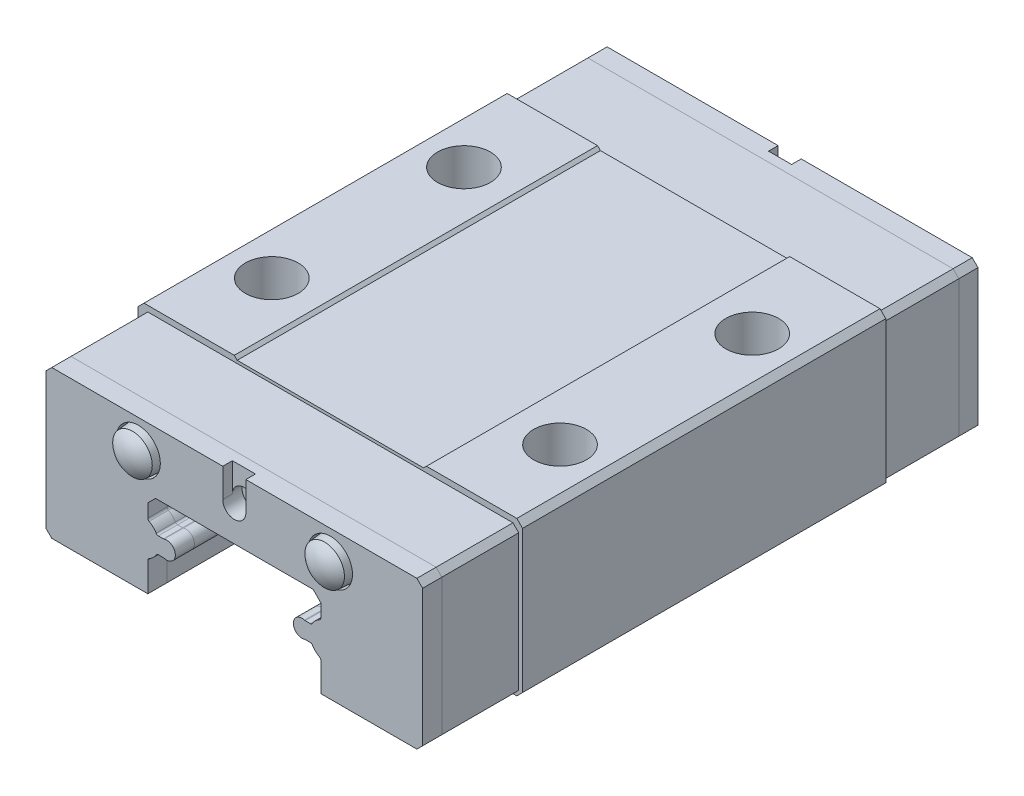
from build123d import *

# Parameters (mm, degrees)
BOSS_EXTRUDE1_DEPTH = 9.45
BOSS_EXTRUDE2_DEPTH = 4
BOSS_EXTRUDE3_DEPTH = 1
SKETCH5_R           = 0.6
CUT_EXTRUDE2_DEPTH  = 28.11475613
SKETCH6_R           = 1.15
SKETCH6_W           = 1.2
SKETCH6_H           = 1.5
CUT_EXTRUDE3_DEPTH  = 0.5
LPATTERN1_COUNT     = 2
LPATTERN1_PITCH     = 10
SKETCH2_R           = 1.375
CUT_EXTRUDE1_DEPTH  = 2.5


with BuildPart() as part:
    # Sketch1 → Boss-Extrude1 (new, symmetric)
    with BuildSketch(Plane.XY):
        with BuildLine():
            Line((4.5, 0), (9.7, 0))
            Line((9.7, 0), (10, 0.3))
            Line((10, 0.3), (10, 7.7))
            Line((10, 7.7), (9.7, 8))
            Line((9.7, 8), (5, 8))
            Line((5, 8), (4.85, 7.85))
            Line((4.85, 7.85), (-4.85, 7.85))
            Line((-4.85, 7.85), (-5, 8))
            Line((-5, 8), (-9.7, 8))
            Line((-9.7, 8), (-10, 7.7))
            Line((-10, 7.7), (-10, 0.3))
            Line((-10, 0.3), (-9.7, 0))
            Line((-9.7, 0), (-4.5, 0))
            Line((-4.5, 0), (-4.5, 1.508002101))
            ThreePointArc((-4.5, 1.508002101), (-4.481535993, 1.574783253), (-4.431388889, 1.622594441))
            ThreePointArc((-4.431388889, 1.622594441), (-4.224528747, 1.772353698), (-4.065036084, 1.971805556))
            ThreePointArc((-4.065036084, 1.971805556), (-4.01760557, 2.018103321), (-3.953514706, 2.035))
            Line((-3.953514706, 2.035), (-3.688448805, 2.035))
            ThreePointArc((-3.688448805, 2.035), (-3.669364148, 2.033591508), (-3.650693039, 2.029396552))
            ThreePointArc((-3.650693039, 2.029396552), (-3.07, 2.46), (-3.650693039, 2.890603448))
            ThreePointArc((-3.650693039, 2.890603448), (-3.669364148, 2.886408492), (-3.688448805, 2.885))
            Line((-3.688448805, 2.885), (-3.953514706, 2.885))
            ThreePointArc((-3.953514706, 2.885), (-4.01760557, 2.901896679), (-4.065036084, 2.948194444))
            ThreePointArc((-4.065036084, 2.948194444), (-4.224528747, 3.147646302), (-4.431388889, 3.297405559))
            ThreePointArc((-4.431388889, 3.297405559), (-4.481535993, 3.345216747), (-4.5, 3.411997899))
            Line((-4.5, 3.411997899), (-4.5, 4.1))
            Line((-4.5, 4.1), (-4.1, 4.5))
            Line((-4.1, 4.5), (4.1, 4.5))
            Line((4.1, 4.5), (4.5, 4.1))
            Line((4.5, 4.1), (4.5, 3.411997899))
            ThreePointArc((4.5, 3.411997899), (4.481535993, 3.345216747), (4.431388889, 3.297405559))
            ThreePointArc((4.431388889, 3.297405559), (4.224528747, 3.147646302), (4.065036084, 2.948194444))
            ThreePointArc((4.065036084, 2.948194444), (4.01760557, 2.901896679), (3.953514706, 2.885))
            Line((3.953514706, 2.885), (3.688448805, 2.885))
            ThreePointArc((3.688448805, 2.885), (3.669364148, 2.886408492), (3.650693039, 2.890603448))
            ThreePointArc((3.650693039, 2.890603448), (3.07, 2.46), (3.650693039, 2.029396552))
            ThreePointArc((3.650693039, 2.029396552), (3.669364148, 2.033591508), (3.688448805, 2.035))
            Line((3.688448805, 2.035), (3.953514706, 2.035))
            ThreePointArc((3.953514706, 2.035), (4.01760557, 2.018103321), (4.065036084, 1.971805556))
            ThreePointArc((4.065036084, 1.971805556), (4.224528747, 1.772353698), (4.431388889, 1.622594441))
            ThreePointArc((4.431388889, 1.622594441), (4.481535993, 1.574783253), (4.5, 1.508002101))
            Line((4.5, 1.508002101), (4.5, 0))
        make_face()
    extrude(amount=BOSS_EXTRUDE1_DEPTH, both=True)

    # Sketch2 → Cut-Extrude1 (cut)
    with BuildSketch(Plane(origin=(0, 8, 0), x_dir=(1, 0, 0), z_dir=(0, 1, 0))):
        with Locations((-7.5, 5)):
            Circle(SKETCH2_R)
        with Locations((7.5, 5)):
            Circle(SKETCH2_R)
        with Locations((7.5, -5)):
            Circle(SKETCH2_R)
        with Locations((-7.5, -5)):
            Circle(SKETCH2_R)
    extrude(amount=-CUT_EXTRUDE1_DEPTH, mode=Mode.SUBTRACT)


with BuildPart() as body_2:
    # Sketch3 → Boss-Extrude2 (new body)
    with BuildSketch(Plane.XY.offset(9.45)):
        with BuildLine():
            Line((9.5, 0), (9.8, 0.3))
            Line((9.8, 0.3), (9.8, 7.4))
            Line((9.8, 7.4), (9.5, 7.7))
            Line((9.5, 7.7), (-9.5, 7.7))
            Line((-9.5, 7.7), (-9.8, 7.4))
            Line((-9.8, 7.4), (-9.8, 0.3))
            Line((-9.8, 0.3), (-9.5, 0))
            Line((-9.5, 0), (-4.5, 0))
            Line((-4.5, 0), (-4.5, 1.508002101))
            ThreePointArc((-4.5, 1.508002101), (-4.481535993, 1.574783253), (-4.431388889, 1.622594441))
            ThreePointArc((-4.431388889, 1.622594441), (-4.224528747, 1.772353698), (-4.065036084, 1.971805556))
            ThreePointArc((-4.065036084, 1.971805556), (-4.01760557, 2.018103321), (-3.953514706, 2.035))
            Line((-3.953514706, 2.035), (-3.688448805, 2.035))
            ThreePointArc((-3.688448805, 2.035), (-3.669364148, 2.033591508), (-3.650693039, 2.029396552))
            ThreePointArc((-3.650693039, 2.029396552), (-3.07, 2.46), (-3.650693039, 2.890603448))
            ThreePointArc((-3.650693039, 2.890603448), (-3.669364148, 2.886408492), (-3.688448805, 2.885))
            Line((-3.688448805, 2.885), (-3.953514706, 2.885))
            ThreePointArc((-3.953514706, 2.885), (-4.01760557, 2.901896679), (-4.065036084, 2.948194444))
            ThreePointArc((-4.065036084, 2.948194444), (-4.224528747, 3.147646302), (-4.431388889, 3.297405559))
            ThreePointArc((-4.431388889, 3.297405559), (-4.481535993, 3.345216747), (-4.5, 3.411997899))
            Line((-4.5, 3.411997899), (-4.5, 4.1))
            Line((-4.5, 4.1), (-4.1, 4.5))
            Line((-4.1, 4.5), (4.1, 4.5))
            Line((4.1, 4.5), (4.5, 4.1))
            Line((4.5, 4.1), (4.5, 3.411997899))
            ThreePointArc((4.5, 3.411997899), (4.481535993, 3.345216747), (4.431388889, 3.297405559))
            ThreePointArc((4.431388889, 3.297405559), (4.224528747, 3.147646302), (4.065036084, 2.948194444))
            ThreePointArc((4.065036084, 2.948194444), (4.01760557, 2.901896679), (3.953514706, 2.885))
            Line((3.953514706, 2.885), (3.688448805, 2.885))
            ThreePointArc((3.688448805, 2.885), (3.669364148, 2.886408492), (3.650693039, 2.890603448))
            ThreePointArc((3.650693039, 2.890603448), (3.07, 2.46), (3.650693039, 2.029396552))
            ThreePointArc((3.650693039, 2.029396552), (3.669364148, 2.033591508), (3.688448805, 2.035))
            Line((3.688448805, 2.035), (3.953514706, 2.035))
            ThreePointArc((3.953514706, 2.035), (4.01760557, 2.018103321), (4.065036084, 1.971805556))
            ThreePointArc((4.065036084, 1.971805556), (4.224528747, 1.772353698), (4.431388889, 1.622594441))
            ThreePointArc((4.431388889, 1.622594441), (4.481535993, 1.574783253), (4.5, 1.508002101))
            Line((4.5, 1.508002101), (4.5, 0))
            Line((4.5, 0), (9.5, 0))
        make_face()
    extrude(amount=BOSS_EXTRUDE2_DEPTH)


with BuildPart() as body_3:
    # Sketch4 → Boss-Extrude3 (new body)
    with BuildSketch(Plane.XY.offset(13.45)):
        with BuildLine():
            Line((-4.5, 0), (-4.5, 1.508002101))
            ThreePointArc((-4.5, 1.508002101), (-4.481535993, 1.574783253), (-4.431388889, 1.622594441))
            ThreePointArc((-4.431388889, 1.622594441), (-4.224528747, 1.772353698), (-4.065036084, 1.971805556))
            ThreePointArc((-4.065036084, 1.971805556), (-4.01760557, 2.018103321), (-3.953514706, 2.035))
            Line((-3.953514706, 2.035), (-3.688448805, 2.035))
            ThreePointArc((-3.688448805, 2.035), (-3.669364148, 2.033591508), (-3.650693039, 2.029396552))
            ThreePointArc((-3.650693039, 2.029396552), (-3.07, 2.46), (-3.650693039, 2.890603448))
            ThreePointArc((-3.650693039, 2.890603448), (-3.669364148, 2.886408492), (-3.688448805, 2.885))
            Line((-3.688448805, 2.885), (-3.953514706, 2.885))
            ThreePointArc((-3.953514706, 2.885), (-4.01760557, 2.901896679), (-4.065036084, 2.948194444))
            ThreePointArc((-4.065036084, 2.948194444), (-4.224528747, 3.147646302), (-4.431388889, 3.297405559))
            ThreePointArc((-4.431388889, 3.297405559), (-4.481535993, 3.345216747), (-4.5, 3.411997899))
            Line((-4.5, 3.411997899), (-4.5, 4.1))
            Line((-4.5, 4.1), (-4.1, 4.5))
            Line((-4.1, 4.5), (4.1, 4.5))
            Line((4.1, 4.5), (4.5, 4.1))
            Line((4.5, 4.1), (4.5, 3.411997899))
            ThreePointArc((4.5, 3.411997899), (4.481535993, 3.345216747), (4.431388889, 3.297405559))
            ThreePointArc((4.431388889, 3.297405559), (4.224528747, 3.147646302), (4.065036084, 2.948194444))
            ThreePointArc((4.065036084, 2.948194444), (4.01760557, 2.901896679), (3.953514706, 2.885))
            Line((3.953514706, 2.885), (3.688448805, 2.885))
            ThreePointArc((3.688448805, 2.885), (3.669364148, 2.886408492), (3.650693039, 2.890603448))
            ThreePointArc((3.650693039, 2.890603448), (3.07, 2.46), (3.650693039, 2.029396552))
            ThreePointArc((3.650693039, 2.029396552), (3.669364148, 2.033591508), (3.688448805, 2.035))
            Line((3.688448805, 2.035), (3.953514706, 2.035))
            ThreePointArc((3.953514706, 2.035), (4.01760557, 2.018103321), (4.065036084, 1.971805556))
            ThreePointArc((4.065036084, 1.971805556), (4.224528747, 1.772353698), (4.431388889, 1.622594441))
            ThreePointArc((4.431388889, 1.622594441), (4.481535993, 1.574783253), (4.5, 1.508002101))
            Line((4.5, 1.508002101), (4.5, 0))
            Line((4.5, 0), (9.5, 0))
            Line((9.5, 0), (9.8, 0.3))
            Line((9.8, 0.3), (9.8, 7.4))
            Line((9.8, 7.4), (9.5, 7.7))
            Line((9.5, 7.7), (-9.5, 7.7))
            Line((-9.5, 7.7), (-9.8, 7.4))
            Line((-9.8, 7.4), (-9.8, 0.3))
            Line((-9.8, 0.3), (-9.5, 0))
            Line((-9.5, 0), (-4.5, 0))
        make_face()
    extrude(amount=BOSS_EXTRUDE3_DEPTH)

    # Sketch5 → Cut-Extrude2 (cut, through all)
    with BuildSketch(Plane.XY.offset(14.45)):
        with Locations((0, 6.2)):
            Circle(SKETCH5_R)
    extrude(amount=-CUT_EXTRUDE2_DEPTH, mode=Mode.SUBTRACT)

    # Sketch6 → Cut-Extrude3 (cut)
    with BuildSketch(Plane.XY.offset(14.45)):
        with Locations((-5, 6.2)):
            Circle(SKETCH6_R)
        with Locations((5, 6.2)):
            Circle(SKETCH6_R)
        with Locations((0, 6.95)):
            Rectangle(SKETCH6_W, SKETCH6_H)
    extrude(amount=-CUT_EXTRUDE3_DEPTH, mode=Mode.SUBTRACT)


with BuildPart() as body_4:
    # Sketch7 → Revolve1 (revolve)
    with BuildSketch(Plane(origin=(0, 6.2, 0), x_dir=(1, 0, 0), z_dir=(0, 1, 0))):
        with BuildLine():
            Line((-5, -13.95), (-3.9, -13.95))
            Line((-3.9, -13.95), (-3.969990931, -14.75))
            ThreePointArc((-3.969990931, -14.75), (-4.447524054, -15.046489733), (-5, -15.15))
            Line((-5, -15.15), (-5, -13.95))
        make_face()
    revolve(axis=Axis((-5, 6.2, 13.95), (0, 0, 1)))


with BuildPart() as lpattern1_1:
    # LPattern1: pattern copy
    add(body_4.part.moved(Location(Vector(1, 0, 0) * (1 * LPATTERN1_PITCH))))


with BuildPart() as body_6:
    # Mirror1: mirrored copy
    add(body_2.part.mirror(Plane.XY))


with BuildPart() as body_7:
    # Mirror1 2: mirrored copy
    add(body_3.part.mirror(Plane.XY))


with BuildPart() as body_8:
    # Mirror1 3: mirrored copy
    add(body_4.part.mirror(Plane.XY))


with BuildPart() as body_9:
    # Mirror1 4: mirrored copy
    add(lpattern1_1.part.mirror(Plane.XY))


solid = Compound([part.part, body_2.part, body_3.part, body_4.part, lpattern1_1.part, body_6.part, body_7.part, body_8.part, body_9.part])
